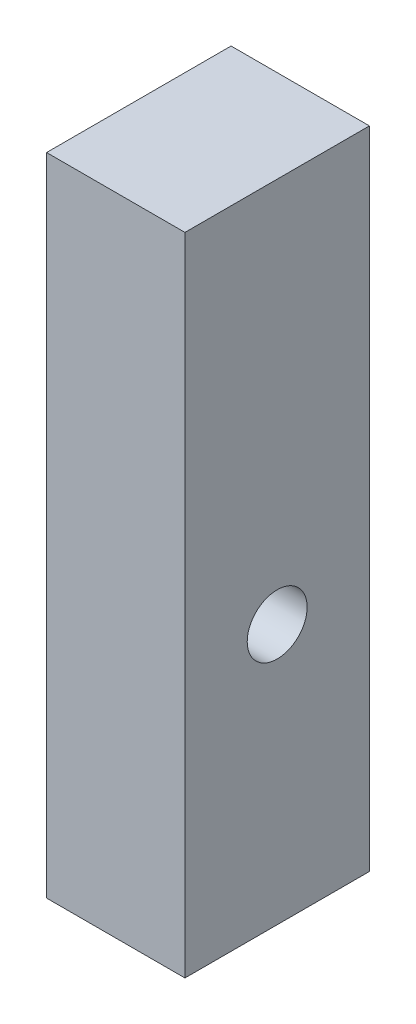
from build123d import *

# Parameters (mm, degrees)
SKETCH18_W         = 15
SKETCH18_H         = 20
PINIONHOLDER_DEPTH = 70
SKETCH19_R         = 3.25
PINIONHOLE_DEPTH   = 73.284161474
SKETCH22_R         = 7.975
BEARINGHOLE_DEPTH  = 2.5


with BuildPart() as part:
    # Sketch18 → PinionHolder (new body)
    with BuildSketch(Plane(origin=(0, 0, 0), x_dir=(-1, 0, 0), z_dir=(0, -1, 0))):
        Rectangle(SKETCH18_W, SKETCH18_H)
    extrude(amount=PINIONHOLDER_DEPTH)

    # Sketch19 → PinionHole (cut, through all)
    with BuildSketch(Plane.ZY.offset(7.5)):
        with Locations((0, -41.8)):
            Circle(SKETCH19_R)
    extrude(amount=-PINIONHOLE_DEPTH, mode=Mode.SUBTRACT)

    # Sketch22 → BearingHole (cut, symmetric)
    with BuildSketch(Plane.ZY):
        with Locations((0, -41.8)):
            Circle(SKETCH22_R)
    extrude(amount=BEARINGHOLE_DEPTH, both=True, mode=Mode.SUBTRACT)


solid = part.part
